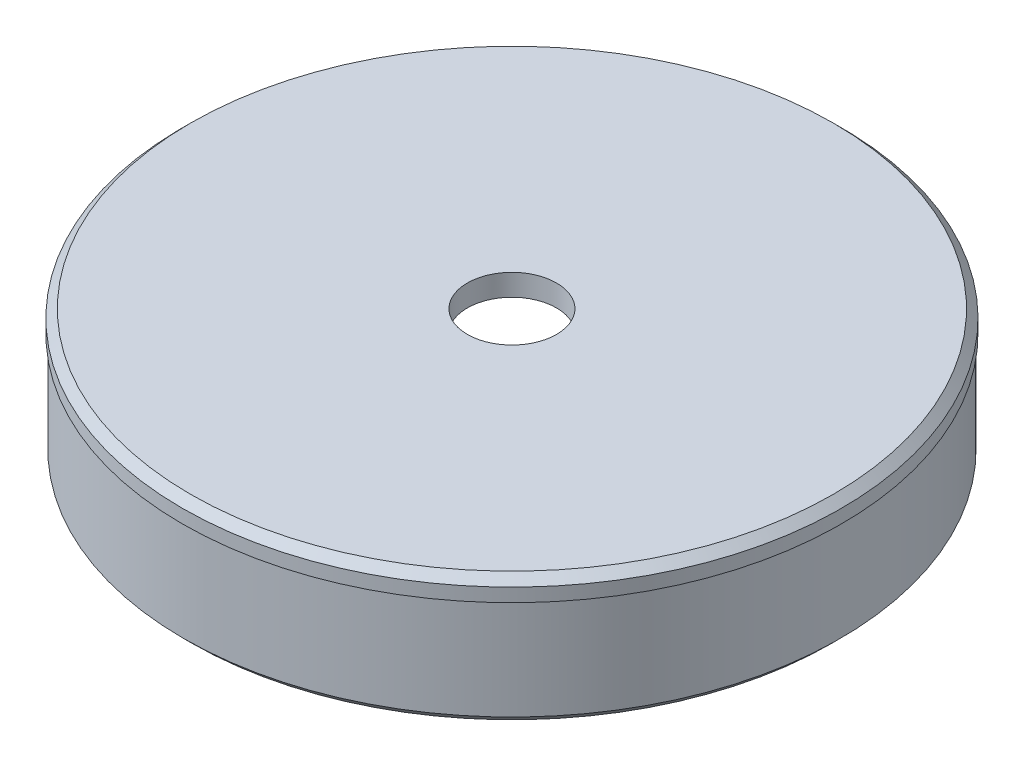
from build123d import *

# Parameters (mm, degrees)
SKETCH1_R           = 7.475
BOSS_EXTRUDE1_DEPTH = 4
SKETCH2_R           = 12.15
SKETCH2_R_2         = 10.15
BOSS_EXTRUDE2_DEPTH = 4
SKETCH3_R           = 12.2
BOSS_EXTRUDE3_DEPTH = 0.8
SKETCH4_R           = 8.294741801
CUT_EXTRUDE1_DEPTH  = 18.711013523
SKETCH5_R           = 1.65
CUT_EXTRUDE2_DEPTH  = 10
CHAMFER1_SIZE       = 0.3


with BuildPart() as part:
    # Sketch1 → Boss-Extrude1 (new body)
    with BuildSketch(Plane(origin=(0, 0, 0), x_dir=(1, 0, 0), z_dir=(0, 1, 0))):
        Circle(SKETCH1_R)
    extrude(amount=BOSS_EXTRUDE1_DEPTH)



with BuildPart() as body_2:
    # Sketch2 → Boss-Extrude2 (new body)
    with BuildSketch(Plane(origin=(0, 0, 0), x_dir=(1, 0, 0), z_dir=(0, 1, 0))):
        Circle(SKETCH2_R)
        Circle(SKETCH2_R_2, mode=Mode.SUBTRACT)
    extrude(amount=BOSS_EXTRUDE2_DEPTH)


with BuildPart() as part_1:
    add(part.part)

    add(body_2.part)  # Boss-Extrude3 merges body 2
    # Sketch3 → Boss-Extrude3 (add)
    with BuildSketch(Plane(origin=(0, 4, 0), x_dir=(1, 0, 0), z_dir=(0, 1, 0))):
        Circle(SKETCH3_R)
    extrude(amount=BOSS_EXTRUDE3_DEPTH)

    # Sketch4 → Cut-Extrude1 (cut, through all)
    with BuildSketch(Plane.XZ.offset(-4)):
        Circle(SKETCH4_R)
    extrude(amount=CUT_EXTRUDE1_DEPTH, mode=Mode.SUBTRACT)

    # Sketch5 → Cut-Extrude2 (cut)
    with BuildSketch(Plane.XZ.offset(-4)):
        Circle(SKETCH5_R)
    extrude(amount=-CUT_EXTRUDE2_DEPTH, mode=Mode.SUBTRACT)

    # Chamfer1
    chamfer1_edges = [part_1.edges().sort_by_distance(p)[0] for p in [
        (-12.2, 4.8, 0),
        (-12.15, 0, 0),
        (-10.15, 4, 0),
        (-10.15, 0, 0),
    ]]
    chamfer(chamfer1_edges, length=CHAMFER1_SIZE)


solid = part_1.part
